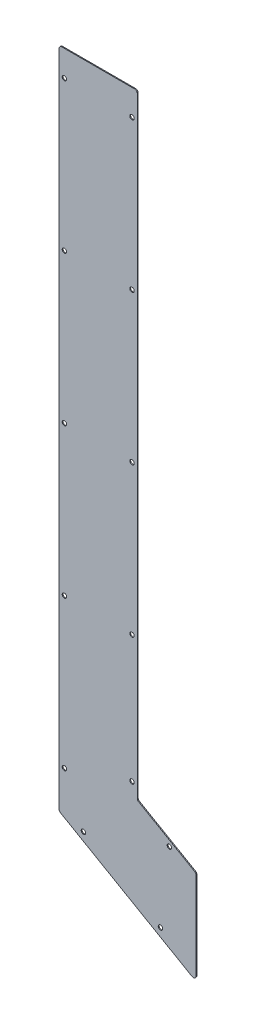
from build123d import *

# Parameters (mm, degrees)
BASE_FLANGE1_DEPTH = 1
SKETCH2_R          = 2.5
CUT_EXTRUDE1_DEPTH = 10
FILLET1_R          = 3


# Sheet-metal steps are written as plain solids
with BuildPart() as part:
    # Sketch1 → Base-Flange1 (new body)
    with BuildSketch(Plane.XY):
        Polygon((104, 853), (16, 853), (16, 107.151941455), (170, 18.24), (170, 123.634882233), (104, 161.74), align=None)
    extrude(amount=-BASE_FLANGE1_DEPTH)

    # Sketch2 → Cut-Extrude1 (cut)
    with BuildSketch(Plane(origin=(0, 0, -1), x_dir=(-1, 0, 0), z_dir=(0, 0, -1))):
        with Locations((-22, 824)):
            Circle(SKETCH2_R)
        with Locations((-98, 824)):
            Circle(SKETCH2_R)
        with Locations((-98, 656)):
            Circle(SKETCH2_R)
        with Locations((-98, 488)):
            Circle(SKETCH2_R)
        with Locations((-98, 320)):
            Circle(SKETCH2_R)
        with Locations((-22, 656)):
            Circle(SKETCH2_R)
        with Locations((-22, 488)):
            Circle(SKETCH2_R)
        with Locations((-22, 320)):
            Circle(SKETCH2_R)
        with Locations((-22, 152)):
            Circle(SKETCH2_R)
        with Locations((-98, 177)):
            Circle(SKETCH2_R)
        with Locations((-140, 134.564882233)):
            Circle(SKETCH2_R)
        with Locations((-130, 50.734882233)):
            Circle(SKETCH2_R)
        with Locations((-43.397459622, 100.734882233)):
            Circle(SKETCH2_R)
    extrude(amount=-CUT_EXTRUDE1_DEPTH, mode=Mode.SUBTRACT)

    # Fillet1
    fillet1_edges = [part.edges().sort_by_distance(p)[0] for p in [
        (104, 161.74, -0.5),
        (170, 123.634882233, -0.5),
        (170, 18.24, -0.5),
        (16, 107.151941455, -0.5),
        (16, 853, -0.5),
        (104, 853, -0.5),
    ]]
    fillet(fillet1_edges, radius=FILLET1_R)


solid = part.part
